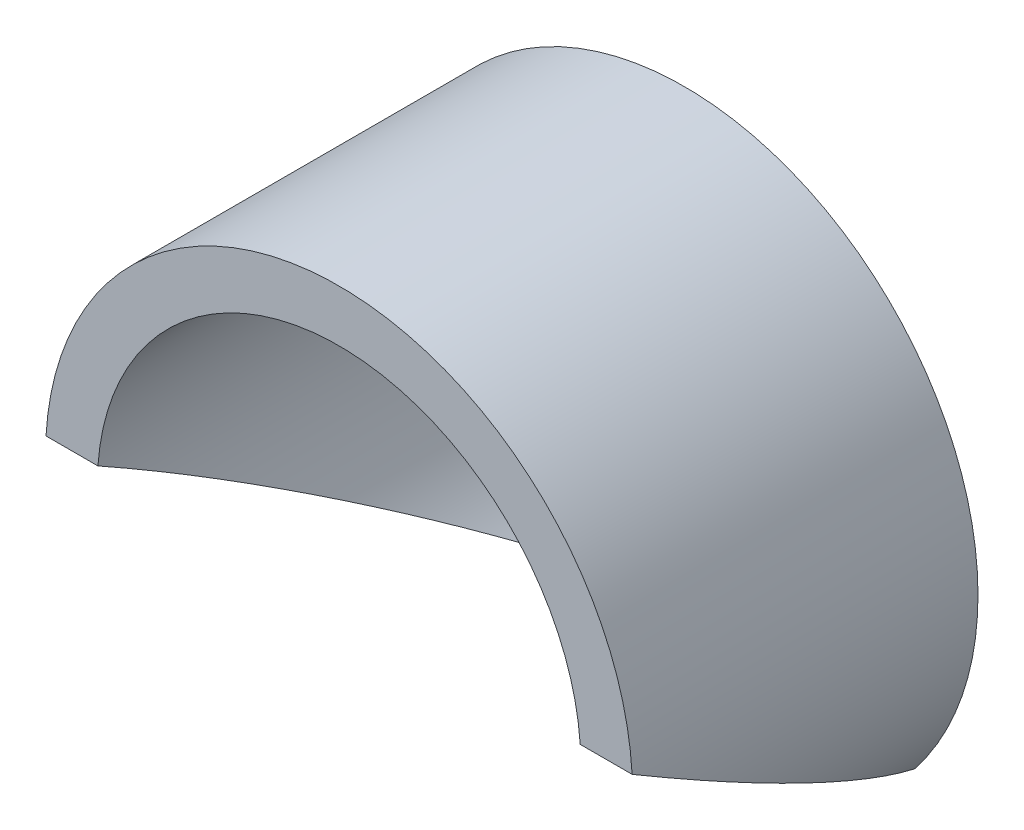
from build123d import *
from OCP.BRepAlgoAPI import BRepAlgoAPI_Cut
from OCP.TopTools import TopTools_ListOfShape

# Parameters (mm, degrees)
BOSS_EXTRUDE1_DEPTH              = 5
SKETCH2_R                        = 2.5
BOSS_EXTRUDE2_DEPTH              = 100
SKETCH3_W                        = 5
SKETCH3_H                        = 5
BOSS_EXTRUDE3_DEPTH              = 10
SKETCH5_W                        = 5
SKETCH5_H                        = 4.330127019
BOSS_EXTRUDE4_DEPTH              = 117
SKETCH6_W                        = 5
SKETCH6_H                        = 5
BOSS_EXTRUDE5_DEPTH              = 20
BOSS_EXTRUDE6_DEPTH              = 15
SKETCH9_W                        = 5
SKETCH9_H                        = 5
BOSS_EXTRUDE7_DEPTH              = 10
SKETCH10_W                       = 5
SKETCH10_H                       = 5
BOSS_EXTRUDE8_DEPTH              = 99.159909
SKETCH11_W                       = 10
SKETCH11_H                       = 3
BOSS_EXTRUDE9_DEPTH              = 10
CUT_EXTRUDE1_DEPTH               = 187.084790711
CUT_EXTRUDE1_DEPTH_BACK          = 187.084790711
SKETCH13_R                       = 2
SKETCH14_W                       = 10
SKETCH14_H                       = 3
BOSS_EXTRUDE10_DEPTH             = 20
CUT_EXTRUDE2_DEPTH               = 194.255140511
CUT_EXTRUDE2_DEPTH_BACK          = 194.255140511
SKETCH15_R                       = 2
BOSS_EXTRUDE11_DEPTH             = 7.8
CUT_EXTRUDE3_DEPTH               = 187.016127587
CUT_EXTRUDE3_DEPTH_BACK          = 187.016127587
SKETCH17_W                       = 22.17902444
SKETCH17_H                       = 20
BOSS_EXTRUDE12_DEPTH             = 5.75
BOSS_EXTRUDE12_DEPTH_BACK        = 5
SKETCH19_W                       = 1.5
SKETCH19_H                       = 10.75
BOSS_EXTRUDE13_DEPTH             = 2.742414
SKETCH21_W                       = 1.5
SKETCH21_H                       = 1
BOSS_EXTRUDE15_DEPTH             = 1
BOSS_EXTRUDE17_REACH             = 195.512
CUT_EXTRUDE4_START               = 2
SKETCH23_W                       = 7.8
SKETCH23_H                       = 12
CUT_EXTRUDE4_DEPTH               = 10
BOSS_EXTRUDE19_DEPTH             = 5
BOSS_EXTRUDE19_DEPTH_BACK        = 2.165064
SKETCH23_2_W                     = 7.8
SKETCH23_2_H                     = 12
CUT_EXTRUDE5_DEPTH               = 1.25
BOSS_EXTRUDE20_REACH             = 188.016
SKETCH25_W                       = 5
SKETCH25_H                       = 4.330127019
SKETCH26_W                       = 5
SKETCH26_H                       = 2.16506351
CUT_EXTRUDE6_DEPTH               = 5
SKETCH27_W                       = 5.75
SKETCH27_H                       = 7.16506351
BOSS_EXTRUDE21_DEPTH             = 5
SKETCH29_W                       = 3
SKETCH29_H                       = 30
BOSS_EXTRUDE22_DEPTH             = 55
SKETCH30_W                       = 5
SKETCH30_H                       = 3
BOSS_EXTRUDE23_DEPTH             = 5
SKETCH31_W                       = 5
SKETCH31_H                       = 5
BOSS_EXTRUDE24_DEPTH             = 33.5
SKETCH32_W                       = 2
SKETCH32_H                       = 19
BOSS_EXTRUDE25_DEPTH             = 12
SKETCH34_W                       = 41
SKETCH34_H                       = 3
CUT_EXTRUDE7_DEPTH               = 30
SKETCH35_W                       = 14
SKETCH35_H                       = 12
BOSS_EXTRUDE26_DEPTH             = 7
BOSS_EXTRUDE27_REACH             = 187.154
SKETCH36_W                       = 9
SKETCH36_H                       = 5
BOSS_EXTRUDE27_DIRECTION_2_REACH = 187.154
SKETCH37_W                       = 41.5
SKETCH37_H                       = 5
BOSS_EXTRUDE28_DEPTH             = 41
SKETCH38_W                       = 34.251665069
SKETCH38_H                       = 27.087918127
CUT_EXTRUDE8_DEPTH               = 185.330721404
SKETCH39_W                       = 67.684653824
SKETCH39_H                       = 30.030202731
CUT_EXTRUDE9_DEPTH               = 190.235302527
SKETCH44_W                       = 5
SKETCH44_H                       = 7.16506351
BOSS_EXTRUDE30_DEPTH             = 18.612596
BOSS_EXTRUDE31_DEPTH             = 20
BOSS_EXTRUDE32_DEPTH             = 15
SKETCH46_W                       = 5
SKETCH46_H                       = 5
EDIT_THIS_LENGTH_DEPTH           = 50
SKETCH47_W                       = 5
SKETCH47_H                       = 3
BOSS_EXTRUDE34_DEPTH             = 5
CUT_EXTRUDE11_DEPTH              = 203.657530065
CUT_EXTRUDE11_DEPTH_BACK         = 203.657530065
SKETCH53_W                       = 268.348847746
SKETCH53_H                       = 124.858242806


with BuildPart() as part:
    # Sketch1 → Boss-Extrude1 (new body)
    with BuildSketch(Plane(origin=(0, 0, 0), x_dir=(1, 0, 0), z_dir=(0, 1, 0))):
        Polygon((121, 0), (0, 0), (0, -68), (5, -68), (5, -5), (116, -5), (116, -68), (121, -68), align=None)
    extrude(amount=BOSS_EXTRUDE1_DEPTH)

    # Sketch2 → Boss-Extrude2 (add)
    with BuildSketch(Plane(origin=(0, 3.75, 2.165063509), x_dir=(1, 0, 0), z_dir=(0, 0.866025403784438, 0.500000000000001))):
        with Locations(Location((118.200131686, -0.299868314, 0), (0, 0, 90))):
            Circle(SKETCH2_R)
    extrude(amount=BOSS_EXTRUDE2_DEPTH)

    # Sketch3 → Boss-Extrude3 (add)
    with BuildSketch(Plane(origin=(121, 0, 0), x_dir=(0, 0, -1), z_dir=(1, 0, 0))):
        with Locations((-2.5, 2.5)):
            Rectangle(SKETCH3_W, SKETCH3_H)
    extrude(amount=BOSS_EXTRUDE3_DEPTH)

    # Sketch5 → Boss-Extrude4 (add)
    with BuildSketch(Plane(origin=(0, 3.75, 2.165063509), x_dir=(1, 0, 0), z_dir=(0, 0.866025403784438, 0.500000000000001))):
        with Locations((128.5, 0.33493649)):
            Rectangle(SKETCH5_W, SKETCH5_H)
    extrude(amount=BOSS_EXTRUDE4_DEPTH)

    # Sketch6 → Boss-Extrude5 (add)
    with BuildSketch(Plane(origin=(0, 1.25, -2.165063509), x_dir=(-1, 0, 0), z_dir=(0, 0.5000000000000009, -0.866025403784438))):
        with Locations((-128.5, 118.830127019)):
            Rectangle(SKETCH6_W, SKETCH6_H)
    extrude(amount=BOSS_EXTRUDE5_DEPTH)

    # Sketch7 → Boss-Extrude6 (add)
    with BuildSketch(Plane.ZY.offset(-126)):
        Polygon((45.509618943, 113.824972243), (41.179491924, 116.324972243), (38.679491924, 111.994845224), (43.009618943, 109.494845224), align=None)
    extrude(amount=BOSS_EXTRUDE6_DEPTH)

    # Sketch9 → Boss-Extrude7 (add)
    with BuildSketch(Plane(origin=(121, 0, 0), x_dir=(0, 0, -1), z_dir=(1, 0, 0))):
        with Locations((-59.75, 2.5)):
            Rectangle(SKETCH9_W, SKETCH9_H)
    extrude(amount=BOSS_EXTRUDE7_DEPTH)

    # Sketch10 → Boss-Extrude8 (add)
    with BuildSketch(Plane(origin=(0, 5, 0), x_dir=(1, 0, 0), z_dir=(0, 1, 0))):
        with Locations((128.5, -59.75)):
            Rectangle(SKETCH10_W, SKETCH10_H)
    extrude(amount=BOSS_EXTRUDE8_DEPTH)

    # Sketch11 → Boss-Extrude9 (add)
    with BuildSketch(Plane.ZY):
        with Locations((57.25, 1.5)):
            Rectangle(SKETCH11_W, SKETCH11_H)
        with Locations((5, 1.5)):
            Rectangle(SKETCH11_W, SKETCH11_H)
    extrude(amount=BOSS_EXTRUDE9_DEPTH)

    # Sketch13 → Cut-Extrude1 (cut, two sides: drawn at the far end of the back side and taken through both)
    with BuildSketch(Plane(origin=(0, 3, 0), x_dir=(1, 0, 0), z_dir=(0, 1, 0)).offset(-CUT_EXTRUDE1_DEPTH_BACK)):
        with Locations(Location((-5, -5, 0), (0, 0, 270))):
            Circle(SKETCH13_R)
        with Locations(Location((-5, -57.25, 0), (0, 0, 270))):
            Circle(SKETCH13_R)
    extrude(amount=CUT_EXTRUDE1_DEPTH + CUT_EXTRUDE1_DEPTH_BACK, mode=Mode.SUBTRACT)

    # Sketch14 → Boss-Extrude10 (add)
    with BuildSketch(Plane(origin=(121, 0, 0), x_dir=(0, 0, -1), z_dir=(1, 0, 0))):
        with Locations((-15, 1.5)):
            Rectangle(SKETCH14_W, SKETCH14_H)
        with Locations((-47.25, 1.5)):
            Rectangle(SKETCH14_W, SKETCH14_H)
    extrude(amount=BOSS_EXTRUDE10_DEPTH)

    # Sketch15 → Cut-Extrude2 (cut, two sides: drawn at the far end of the back side and taken through both)
    with BuildSketch(Plane(origin=(0, 3, 0), x_dir=(1, 0, 0), z_dir=(0, 1, 0)).offset(-CUT_EXTRUDE2_DEPTH_BACK)):
        with Locations(Location((136, -15, 0), (0, 0, 270))):
            Circle(SKETCH15_R)
        with Locations(Location((136, -47.25, 0), (0, 0, 270))):
            Circle(SKETCH15_R)
    extrude(amount=CUT_EXTRUDE2_DEPTH + CUT_EXTRUDE2_DEPTH_BACK, mode=Mode.SUBTRACT)

    # Sketch16 → Boss-Extrude11 (add)
    with BuildSketch(Plane.ZY.offset(-126)):
        Polygon((49.839745962, 111.324972243), (67, 101.417494955), (64.5, 97.087367936), (47.339745962, 106.994845224), align=None)
    extrude(amount=BOSS_EXTRUDE11_DEPTH)

    # Sketch17 → Cut-Extrude3 (cut, two sides: drawn at the far end of the back side and taken through both)
    with BuildSketch(Plane(origin=(0, 105.074972243, 60.665063509), x_dir=(1, 0, 0), z_dir=(0, 0.8660254037844382, 0.500000000000001)).offset(-CUT_EXTRUDE3_DEPTH_BACK)):
        with Locations((119.91048778, 12.5)):
            Rectangle(SKETCH17_W, SKETCH17_H)
    extrude(amount=CUT_EXTRUDE3_DEPTH + CUT_EXTRUDE3_DEPTH_BACK, mode=Mode.SUBTRACT)



with BuildPart() as body_2:
    # Sketch18 → Boss-Extrude12 (new, two sides: drawn at the far end of the back side and taken through both)
    with BuildSketch(Plane.XY.offset(62.25).offset(-BOSS_EXTRUDE12_DEPTH_BACK)):
        with BuildLine():
            Line((118.2, 104.159908733), (119.7, 104.159908733))
            ThreePointArc((119.7, 104.159908733), (110.2, 113.659908733), (100.7, 104.159908733))
            Line((100.7, 104.159908733), (102.2, 104.159908733))
            ThreePointArc((102.2, 104.159908733), (110.2, 112.159908733), (118.2, 104.159908733))
        make_face()
    extrude(amount=BOSS_EXTRUDE12_DEPTH + BOSS_EXTRUDE12_DEPTH_BACK)


with BuildPart() as part_1:
    add(part.part)

    add(body_2.part)  # Boss-Extrude13 merges body 2
    # Sketch19 → Boss-Extrude13 (add)
    with BuildSketch(Plane.XZ.offset(-104.159908733)):
        with Locations((118.95, 62.625)):
            Rectangle(SKETCH19_W, SKETCH19_H)
    extrude(amount=BOSS_EXTRUDE13_DEPTH)

    # Sketch21 → Boss-Extrude15 (add)
    with BuildSketch(Plane.XZ.offset(-101.417494955)):
        with Locations((118.95, 67.5)):
            Rectangle(SKETCH21_W, SKETCH21_H)
    extrude(amount=BOSS_EXTRUDE15_DEPTH)

    # Boss-Extrude17: up to this plane
    boss_extrude17_end = Plane(origin=(119.7, 101.417494955, 68), z_dir=(0, 0, -1))
    # Sketch20 → Boss-Extrude17 (add, up to the surface)
    with BuildSketch(Plane(origin=(0, -3.657477288, 6.334936491), x_dir=(1, 0, 0), z_dir=(0, -0.5000000000000039, 0.8660254037844365)), mode=Mode.PRIVATE) as boss_extrude17_sk1:
        Polygon((126, 116.330127019), (126, 121.330127019), (119.7, 121.330127019), (118.2, 121.330127019), (118.2, 116.330127019), align=None)
    boss_extrude17_tool1 = split(extrude(boss_extrude17_sk1.sketch, amount=BOSS_EXTRUDE17_REACH, mode=Mode.PRIVATE), bisect_by=boss_extrude17_end, keep=Keep.BOTH, mode=Mode.PRIVATE)
    add(boss_extrude17_tool1.solids().sort_by_distance((122.1, 99.252431, 65.75))[0])

    # Sketch23 → Cut-Extrude4 (cut)
    with BuildSketch(Plane(origin=(0, 104.159908733, 0), x_dir=(-1, 0, 0), z_dir=(0, -1, 0)).offset(CUT_EXTRUDE4_START)):
        with Locations((-122.1, -62)):
            Rectangle(SKETCH23_W, SKETCH23_H)
    extrude(amount=CUT_EXTRUDE4_DEPTH, mode=Mode.SUBTRACT)

    # Sketch23<2> → Boss-Extrude19 (add, two sides: drawn at the far end of the back side and taken through both)
    with BuildSketch(Plane(origin=(0, 104.159908733, 0), x_dir=(-1, 0, 0), z_dir=(0, -1, 0)).offset(-BOSS_EXTRUDE19_DEPTH_BACK)):
        with Locations((-122.1, -62)):
            Rectangle(SKETCH23_2_W, SKETCH23_2_H)
    extrude(amount=BOSS_EXTRUDE19_DEPTH + BOSS_EXTRUDE19_DEPTH_BACK)


with BuildPart() as cut_extrude5_tool:
    # Sketch24 → Cut-Extrude5 (new body)
    with BuildSketch(Plane(origin=(0, 0, 56), x_dir=(-1, 0, 0), z_dir=(0, 0, -1))):
        Polygon((-126, 106.324972243), (-126, 101.994845224), (-126, 99.159908733), (-118.2, 99.159908733), (-118.2, 106.324972243), align=None)
    extrude(amount=-CUT_EXTRUDE5_DEPTH)


with BuildPart() as part_2:
    add(part_1.part)

    # Cut-Extrude5: cut by cut_extrude5_tool, with a tolerance
    cut_extrude5_stock = TopTools_ListOfShape()
    cut_extrude5_stock.Append(part_2.part.wrapped)
    cut_extrude5_tools = TopTools_ListOfShape()
    cut_extrude5_tools.Append(cut_extrude5_tool.part.wrapped)
    cut_extrude5_cut = BRepAlgoAPI_Cut()
    cut_extrude5_cut.SetArguments(cut_extrude5_stock)
    cut_extrude5_cut.SetTools(cut_extrude5_tools)
    cut_extrude5_cut.SetFuzzyValue(0.00001)
    cut_extrude5_cut.Build()
    add(Compound.cast(cut_extrude5_cut.Shape()).solids(), mode=Mode.REPLACE)

    # Boss-Extrude20: up to this face of the body (flat: up to its plane)
    boss_extrude20_end = Plane(part_2.part.faces().sort_by_distance((122.724999943, 106.324972733, 62.625))[0])
    # Sketch25 → Boss-Extrude20 (add, up to the picked face)
    with BuildSketch(Plane(origin=(0, 105.074972243, 60.665063509), x_dir=(1, 0, 0), z_dir=(0, 0.8660254037844382, 0.500000000000001)), mode=Mode.PRIVATE) as boss_extrude20_sk1:
        with Locations((128.5, 0.33493649)):
            Rectangle(SKETCH25_W, SKETCH25_H)
    boss_extrude20_tool1 = split(extrude(boss_extrude20_sk1.sketch, amount=BOSS_EXTRUDE20_REACH, mode=Mode.PRIVATE), bisect_by=boss_extrude20_end, keep=Keep.BOTH, mode=Mode.PRIVATE)
    add(boss_extrude20_tool1.solids().sort_by(Axis((128.5, 105.24244, 60.375), (0, 0.8660254037844382, 0.500000000000001)))[0])


with BuildPart() as cut_extrude6_tool:
    # Sketch26 → Cut-Extrude6 (new body)
    with BuildSketch(Plane.XY.offset(62.25)):
        with Locations((128.5, 105.242440488)):
            Rectangle(SKETCH26_W, SKETCH26_H)
    extrude(amount=CUT_EXTRUDE6_DEPTH)


with BuildPart() as part_3:
    add(part_2.part)

    # Cut-Extrude6: cut by cut_extrude6_tool, with a tolerance
    cut_extrude6_stock = TopTools_ListOfShape()
    cut_extrude6_stock.Append(part_3.part.wrapped)
    cut_extrude6_tools = TopTools_ListOfShape()
    cut_extrude6_tools.Append(cut_extrude6_tool.part.wrapped)
    cut_extrude6_cut = BRepAlgoAPI_Cut()
    cut_extrude6_cut.SetArguments(cut_extrude6_stock)
    cut_extrude6_cut.SetTools(cut_extrude6_tools)
    cut_extrude6_cut.SetFuzzyValue(0.00001)
    cut_extrude6_cut.Build()
    add(Compound.cast(cut_extrude6_cut.Shape()).solids(), mode=Mode.REPLACE)

    # Sketch27 → Boss-Extrude21 (add)
    with BuildSketch(Plane(origin=(126, 0, 0), x_dir=(0, 0, -1), z_dir=(1, 0, 0))):
        with Locations((-65.125, 102.742440488)):
            Rectangle(SKETCH27_W, SKETCH27_H)
    extrude(amount=BOSS_EXTRUDE21_DEPTH)

    # Sketch29 → Boss-Extrude22 (add)
    with BuildSketch(Plane.ZY):
        with Locations((40, 20)):
            Rectangle(SKETCH29_W, SKETCH29_H)
    extrude(amount=-BOSS_EXTRUDE22_DEPTH)

    # Sketch30 → Boss-Extrude23 (add)
    with BuildSketch(Plane.XZ.offset(-5)):
        with Locations((52.5, 40)):
            Rectangle(SKETCH30_W, SKETCH30_H)
    extrude(amount=BOSS_EXTRUDE23_DEPTH)

    # Sketch31 → Boss-Extrude24 (add)
    with BuildSketch(Plane(origin=(0, 0, 38.5), x_dir=(-1, 0, 0), z_dir=(0, 0, -1))):
        with Locations((-52.5, 2.5)):
            Rectangle(SKETCH31_W, SKETCH31_H)
    extrude(amount=BOSS_EXTRUDE24_DEPTH)

    # Sketch32 → Boss-Extrude25 (add)
    with BuildSketch(Plane(origin=(0, 0, 38.5), x_dir=(-1, 0, 0), z_dir=(0, 0, -1))):
        Polygon((-41, 9), (-53, 9), (-53, 35), (-55, 35), (-55, 7), (-41, 7), align=None)
        with Locations((-42, 25.5)):
            Rectangle(SKETCH32_W, SKETCH32_H)
    extrude(amount=BOSS_EXTRUDE25_DEPTH)

    # Sketch34 → Cut-Extrude7 (cut)
    with BuildSketch(Plane(origin=(0, 35, 0), x_dir=(1, 0, 0), z_dir=(0, 1, 0))):
        with Locations((20.5, -40)):
            Rectangle(SKETCH34_W, SKETCH34_H)
    extrude(amount=-CUT_EXTRUDE7_DEPTH, mode=Mode.SUBTRACT)

    # Sketch35 → Boss-Extrude26 (add)
    with BuildSketch(Plane.XZ.offset(-7)):
        with Locations((48, 32.5)):
            Rectangle(SKETCH35_W, SKETCH35_H)
    extrude(amount=BOSS_EXTRUDE26_DEPTH)

    # Boss-Extrude27: up to this face of the body (flat: up to its plane)
    boss_extrude27_end = Plane(part_3.part.faces().sort_by_distance((48.252808989, 19.016853933, 41.5))[0])
    # Sketch36 → Boss-Extrude27 (add, up to the picked face)
    with BuildSketch(Plane.XY.offset(38.5), mode=Mode.PRIVATE) as boss_extrude27_sk1:
        with Locations((45.5, 2.5)):
            Rectangle(SKETCH36_W, SKETCH36_H)
    boss_extrude27_tool1 = split(extrude(boss_extrude27_sk1.sketch, amount=BOSS_EXTRUDE27_REACH, mode=Mode.PRIVATE), bisect_by=boss_extrude27_end, keep=Keep.BOTH, mode=Mode.PRIVATE)
    add(boss_extrude27_tool1.solids().sort_by(Axis((45.5, 2.5, 38.5), (0, 0, 1)))[0])

    # Boss-Extrude27 direction 2: up to this face of the body (flat: up to its plane)
    boss_extrude27_direction_2_end = Plane(part_3.part.faces().sort_by_distance((27.5, 2.5, 5))[0])
    # Sketch36 → Boss-Extrude27 direction 2 (add, up to the picked face)
    with BuildSketch(Plane.XY.offset(38.5), mode=Mode.PRIVATE) as boss_extrude27_direction_2_sk1:
        with Locations((45.5, 2.5)):
            Rectangle(SKETCH36_W, SKETCH36_H)
    boss_extrude27_direction_2_tool1 = split(extrude(boss_extrude27_direction_2_sk1.sketch, amount=-BOSS_EXTRUDE27_DIRECTION_2_REACH, mode=Mode.PRIVATE), bisect_by=boss_extrude27_direction_2_end, keep=Keep.BOTH, mode=Mode.PRIVATE)
    add(boss_extrude27_direction_2_tool1.solids().sort_by(Axis((45.5, 2.5, 38.5), (0, 0, -1)))[0])

    # Sketch37 → Boss-Extrude28 (add)
    with BuildSketch(Plane.ZY.offset(-41)):
        with Locations((20.75, 2.5)):
            Rectangle(SKETCH37_W, SKETCH37_H)
    extrude(amount=BOSS_EXTRUDE28_DEPTH)

    # Sketch38 → Cut-Extrude8 (cut, through all)
    with BuildSketch(Plane.ZY.offset(-118.2)):
        with Locations((61.183105348, 109.662346151)):
            Rectangle(SKETCH38_W, SKETCH38_H)
    extrude(amount=CUT_EXTRUDE8_DEPTH, mode=Mode.SUBTRACT)

    # Sketch39 → Cut-Extrude9 (cut, through all)
    with BuildSketch(Plane(origin=(0, 106.324972243, 0), x_dir=(1, 0, 0), z_dir=(0, 1, 0))):
        with Locations((120.498501698, -57.225220953)):
            Rectangle(SKETCH39_W, SKETCH39_H)
    extrude(amount=CUT_EXTRUDE9_DEPTH, mode=Mode.SUBTRACT)

    # Sketch44 → Boss-Extrude30 (add)
    with BuildSketch(Plane.ZY.offset(-118.2)):
        with Locations((59.75, 102.742440488)):
            Rectangle(SKETCH44_W, SKETCH44_H)
    extrude(amount=BOSS_EXTRUDE30_DEPTH)

    # Sketch43 → Boss-Extrude31 (add)
    with BuildSketch(Plane(origin=(0, 0, 57.25), x_dir=(-1, 0, 0), z_dir=(0, 0, -1))):
        with BuildLine():
            Line((-122.200131686, 106.324972243), (-126, 106.324972243))
            Line((-126, 106.324972243), (-126.312859701, 106.324972243))
            ThreePointArc((-126.312859701, 106.324972243), (-112.950131686, 133.833897021), (-99.587403671, 106.324972243))
            Line((-99.587403671, 106.324972243), (-103.700131686, 106.324972243))
            ThreePointArc((-103.700131686, 106.324972243), (-112.950131686, 130.833897021), (-122.200131686, 106.324972243))
        make_face()
    extrude(amount=-BOSS_EXTRUDE31_DEPTH)

    # Sketch45 → Boss-Extrude32 (add)
    with BuildSketch(Plane.XY.offset(62.25)):
        Polygon((118.2, 99.159908733), (118.2, 106.324972243), (103.700131686, 106.324972243), (99.587403671, 106.324972243), (99.587403671, 99.159908733), align=None)
    extrude(amount=BOSS_EXTRUDE32_DEPTH)

    # Sketch46 → EDIT THIS LENGTH (add)
    with BuildSketch(Plane.XY.offset(62.25)):
        with Locations((128.5, 86.659908733)):
            Rectangle(SKETCH46_W, SKETCH46_H)
    extrude(amount=EDIT_THIS_LENGTH_DEPTH)

    # Sketch47 → Boss-Extrude34 (add)
    with BuildSketch(Plane(origin=(0, 89.159908733, 0), x_dir=(1, 0, 0), z_dir=(0, 1, 0))):
        with Locations((128.5, -110.75)):
            Rectangle(SKETCH47_W, SKETCH47_H)
    extrude(amount=BOSS_EXTRUDE34_DEPTH)

    # Sketch53 → Cut-Extrude11 (cut, two sides: drawn at the far end of the back side and taken through both)
    with BuildSketch(Plane(origin=(0, 0, 57.25), x_dir=(-1, 0, 0), z_dir=(0, 0, -1)).offset(-CUT_EXTRUDE11_DEPTH_BACK)):
        with Locations((-70.998175197, 43.89585084)):
            Rectangle(SKETCH53_W, SKETCH53_H)
    extrude(amount=CUT_EXTRUDE11_DEPTH + CUT_EXTRUDE11_DEPTH_BACK, mode=Mode.SUBTRACT)


with BuildPart() as cut_extrude11_kept_piece:
    # of the separate pieces the step leaves, the one the design keeps (cut_extrude11_pieces_kept)
    add(part_3.part.solids().sort_by_distance((126.312859701, 106.324972243, 57.25))[0])

    # Chamfer1
    # the kernel refuses this chamfer: 19.918584287, 11.5 mm, written as the material it takes off along each edge
    with BuildSketch(Plane(origin=(177.843945363, 106.324972243, 77.25), x_dir=(0, 0, -1), z_dir=(-1, 0, 0)), Plane(origin=(155.231217348, 106.324972243, 77.25), x_dir=(0, 0, -1), z_dir=(-1, 0, 0))) as chamfer1_piece_1:
        with BuildLine():
            Line((20.608584287, 0.398371686), (-0.69, -11.898371686))
            Line((-0.69, -11.898371686), (-1.088371686, -11.898371686))
            ThreePointArc((-1.088371686, -11.898371686), (-0.398371686, -5.949185843), (-0.398371686, 0))
            Line((-0.398371686, 0), (0, 0.398371686))
            ThreePointArc((0, 0.398371686), (10.304292144, 0.398371686), (20.608584287, 0.796743371))
            Line((20.608584287, 0.796743371), (20.608584287, 0.398371686))
        make_face()
    extrude(amount=107.174899338, mode=Mode.SUBTRACT)


solid = cut_extrude11_kept_piece.part
